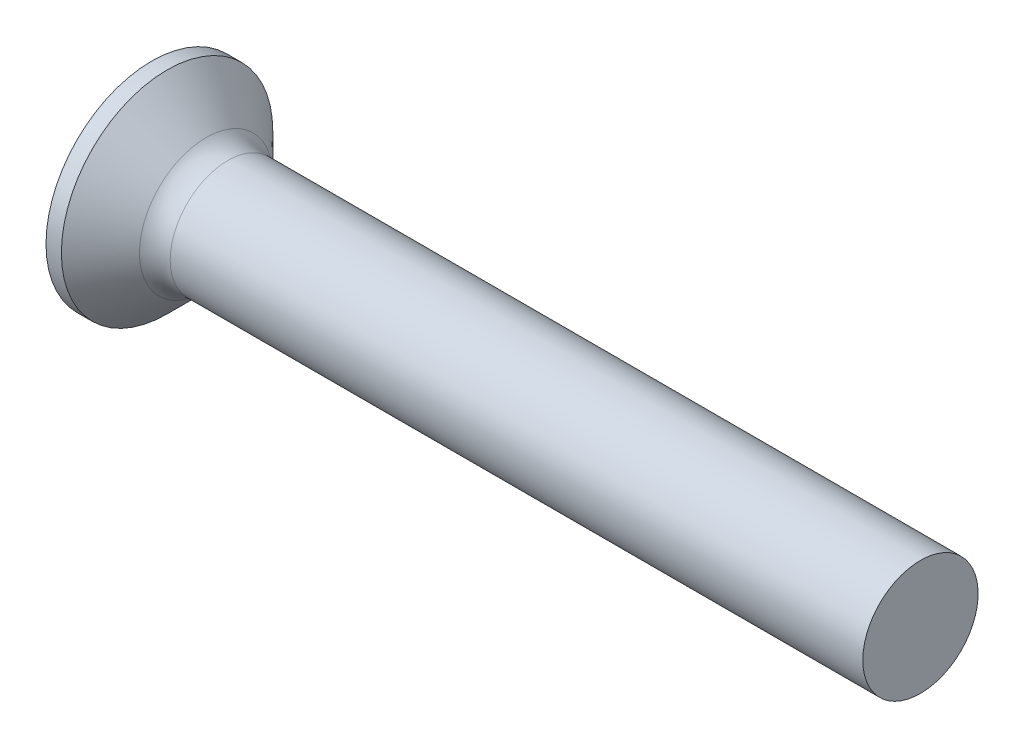
from build123d import *

# Parameters (mm, degrees)
FILLET1_R    = 0.8
RECPAT_COUNT = 2
RECPAT_ANGLE = 90


with BuildPart() as part:
    # BodySke → Base-Revolve (revolve)
    with BuildSketch(Plane.XY):
        Polygon((0, 0), (0, 2.75), (0.4, 2.75), (1.65, 1.5), (20, 1.5), (20, 0), align=None)
    revolve(axis=Axis((-6.35, 0, 0), (1, 0, 0)))

    # Fillet1
    fillet1_edges = [part.edges().sort_by_distance(p)[0] for p in [
        (1.65, -1.5, 0),
    ]]
    fillet(fillet1_edges, radius=FILLET1_R)

    # Sketch3 → Recess section 0
    with BuildSketch(Plane.ZY):
        with BuildLine():
            Line((-0.37, 1.5), (0.37, 1.5))
            Line((0.37, 1.5), (0.37, -1.5))
            Line((0.37, -1.5), (-0.37, -1.5))
            Line((-0.37, -1.5), (-0.37, 1.5))
        make_face()
    # Sketch4 → Recess section 1
    with BuildSketch(Plane.ZY.offset(-2.01)):
        with BuildLine():
            Line((-0.37, 0.497851135), (0.37, 0.497851135))
            Line((0.37, 0.497851135), (0.37, -0.497851135))
            Line((0.37, -0.497851135), (-0.37, -0.497851135))
            Line((-0.37, -0.497851135), (-0.37, 0.497851135))
        make_face()
    recess = loft(mode=Mode.SUBTRACT)

    # RecPat: Recess ×2 about axis
    recpat_axis = Axis((0, 0, 0), (1, 0, 0))
    for i in range(1, RECPAT_COUNT):
        add(recess.rotate(recpat_axis, i * RECPAT_ANGLE / (RECPAT_COUNT - 1)), mode=Mode.SUBTRACT)

    # RecCorSke → RecessCore (revolve, cut)
    with BuildSketch(Plane.XY):
        Polygon((0, 0), (0, 0.696552892), (2.01, 0.556), (2.190655351, 0), align=None)
    revolve(axis=Axis((-3.175, 0, 0), (1, 0, 0)), mode=Mode.SUBTRACT)


solid = part.part
